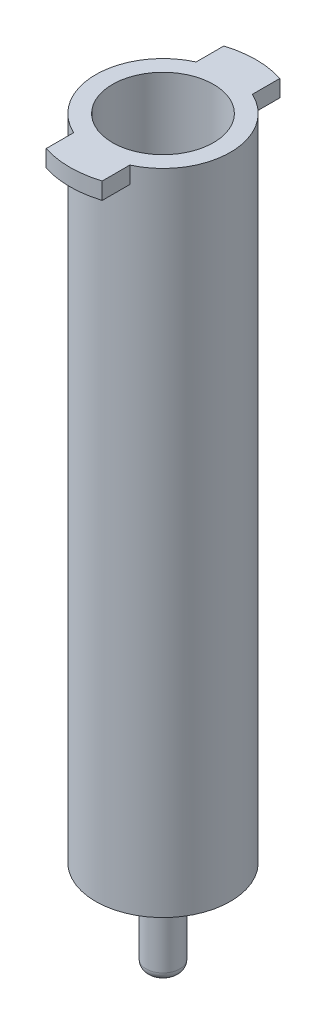
from build123d import *

# Parameters (mm, degrees)
SKETCH1_R           = 6
BOSS_EXTRUDE1_DEPTH = 58.5
SHELL1_T            = -1.5
SKETCH3_R           = 2.5
BOSS_EXTRUDE2_DEPTH = 1.3
SKETCH4_R           = 1.5
BOSS_EXTRUDE3_DEPTH = 6.2
SKETCH5_R           = 0.7
CUT_EXTRUDE1_DEPTH  = 67.543219038
FILLET1_R           = 0.75
CHAMFER1_SIZE       = 5
CHAMFER1_SIZE_2     = 0.702704174
BOSS_EXTRUDE4_START = -1.5
BOSS_EXTRUDE4_DEPTH = 1.5


with BuildPart() as part:
    # Sketch1 → Boss-Extrude1 (new body)
    with BuildSketch(Plane(origin=(0, 0, 0), x_dir=(1, 0, 0), z_dir=(0, 1, 0))):
        with Locations(Location((0, 0, 0), (0, 0, 270))):
            Circle(SKETCH1_R)
    extrude(amount=BOSS_EXTRUDE1_DEPTH)

    # Shell1
    shell1_openings = [part.faces().sort_by_distance(p)[0] for p in [
        (0, 58.5, 0),
    ]]
    offset(amount=SHELL1_T, openings=shell1_openings, kind=Kind.INTERSECTION)

    # Sketch3 → Boss-Extrude2 (add)
    with BuildSketch(Plane.XZ):
        with Locations(Location((0, 0, 0), (0, 0, 270))):
            Circle(SKETCH3_R)
    extrude(amount=BOSS_EXTRUDE2_DEPTH)

    # Sketch4 → Boss-Extrude3 (add)
    with BuildSketch(Plane.XZ.offset(1.3)):
        with Locations(Location((0, 0, 0), (0, 0, 90))):
            Circle(SKETCH4_R)
    extrude(amount=BOSS_EXTRUDE3_DEPTH)

    # Sketch5 → Cut-Extrude1 (cut, through all)
    with BuildSketch(Plane.XZ.offset(7.5)):
        with Locations(Location((0, 0, 0), (0, 0, 270))):
            Circle(SKETCH5_R)
    extrude(amount=-CUT_EXTRUDE1_DEPTH, mode=Mode.SUBTRACT)

    # Fillet1
    fillet1_edges = [part.edges().sort_by_distance(p)[0] for p in [
        (0, -7.5, -1.5),
    ]]
    fillet(fillet1_edges, radius=FILLET1_R)

    # Chamfer1
    # the kernel refuses this chamfer: 5, 0.702704174 mm, written as the material it takes off along each edge
    with BuildSketch(Plane(origin=(0, 0, 0), x_dir=(0, 0, 1), z_dir=(-1, 0, 0))) as chamfer1_piece_1_section:
        Polygon((6 - CHAMFER1_SIZE, 0), (6, CHAMFER1_SIZE_2), (6, 0), align=None)
    chamfer1_piece_1 = revolve(axis=Axis((0, 0, 0), (0, 1, 0)), mode=Mode.PRIVATE)
    chamfer1_piece_1 = chamfer1_piece_1 - Plane(origin=(0, 0.432162163, 0), x_dir=(0, 0, -1), z_dir=(0, 1, 0)) * Cylinder(2.5, 24, mode=Mode.PRIVATE)
    add(chamfer1_piece_1, mode=Mode.SUBTRACT)

    # Sketch6 → Boss-Extrude4 (add)
    with BuildSketch(Plane(origin=(0, 58.5, 0), x_dir=(1, 0, 0), z_dir=(0, 1, 0)).offset(BOSS_EXTRUDE4_START)):
        with BuildLine():
            Line((2.5, 5.454356057), (2.5, 7.914543575))
            ThreePointArc((2.5, 7.914543575), (0, 8.3), (-2.5, 7.914543575))
            Line((-2.5, 7.914543575), (-2.5, 5.454356057))
            ThreePointArc((-2.5, 5.454356057), (0, 6), (2.5, 5.454356057))
        make_face()
        with BuildLine():
            Line((-2.5, -5.454356057), (-2.5, -7.914543575))
            ThreePointArc((-2.5, -7.914543575), (0, -8.3), (2.5, -7.914543575))
            Line((2.5, -7.914543575), (2.5, -5.454356057))
            ThreePointArc((2.5, -5.454356057), (0, -6), (-2.5, -5.454356057))
        make_face()
    extrude(amount=BOSS_EXTRUDE4_DEPTH)


solid = part.part
